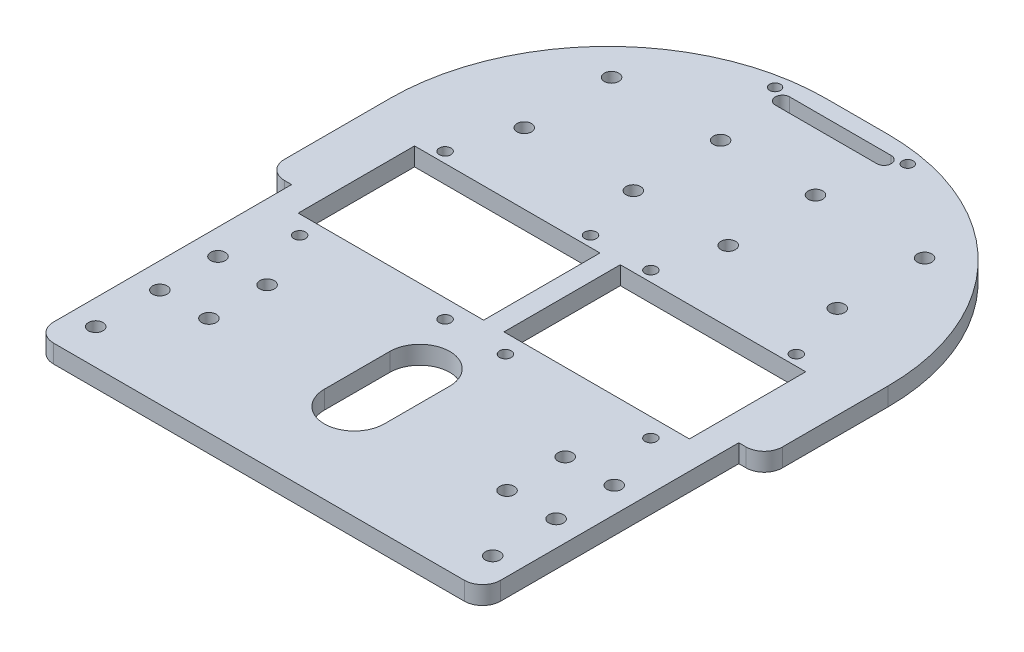
from build123d import *

# Parameters (mm, degrees)
BOSS_EXTRUDE2_DEPTH = 5
FILLET8_R           = 60
SKETCH4_R           = 2
SKETCH4_R_2         = 1.605
SKETCH4_R_3         = 1.5
SKETCH4_W           = 51
SKETCH4_H           = 32
CUT_EXTRUDE1_DEPTH  = 5
FILLET17_R          = 5


with BuildPart() as part:
    # Sketch1 → Boss-Extrude2 (new body)
    with BuildSketch(Plane(origin=(0, 0, 0), x_dir=(1, 0, 0), z_dir=(0, 1, 0))):
        Polygon((68.5, 80), (-68.5, 80), (-68.5, -14), (-61.5, -14), (-61.5, -84.5), (61.5, -84.5), (61.5, -14), (68.5, -14), align=None)
    extrude(amount=BOSS_EXTRUDE2_DEPTH)

    # Fillet8
    fillet8_edges = [part.edges().sort_by_distance(p)[0] for p in [
        (68.5, 2.5, -80),
        (-68.5, 2.5, -80),
    ]]
    fillet(fillet8_edges, radius=FILLET8_R)

    # Sketch4 → Cut-Extrude1 (cut)
    with BuildSketch(Plane(origin=(0, 5, 0), x_dir=(1, 0, 0), z_dir=(0, 1, 0))):
        with Locations((-41, -41.25)):
            Circle(SKETCH4_R)
        with Locations((41, -41.25)):
            Circle(SKETCH4_R)
        with Locations((41, -57.25)):
            Circle(SKETCH4_R)
        with Locations((-41, -57.25)):
            Circle(SKETCH4_R)
        with Locations((-54.5, -41.25)):
            Circle(SKETCH4_R)
        with Locations((-54.5, -57.25)):
            Circle(SKETCH4_R)
        with Locations((54.5, -57.25)):
            Circle(SKETCH4_R)
        with Locations((54.5, -41.25)):
            Circle(SKETCH4_R)
        with Locations((-48.298883815, 15.012633239)):
            Circle(SKETCH4_R_2)
        with Locations((-8.298883815, 15.012633239)):
            Circle(SKETCH4_R_2)
        with Locations((-48.298883815, -24.987366761)):
            Circle(SKETCH4_R_2)
        with Locations((-8.298883815, -24.987366761)):
            Circle(SKETCH4_R_2)
        with Locations((48.298883815, -24.987366761)):
            Circle(SKETCH4_R_2)
        with Locations((8.298883815, -24.987366761)):
            Circle(SKETCH4_R_2)
        with Locations((8.298883815, 15.012633239)):
            Circle(SKETCH4_R_2)
        with Locations((48.298883815, 15.012633239)):
            Circle(SKETCH4_R_2)
        with Locations((13.047144734, 55.54428083)):
            Circle(SKETCH4_R)
        with Locations((43.047144734, 55.54428083)):
            Circle(SKETCH4_R)
        with Locations((43.047144734, 31.54428083)):
            Circle(SKETCH4_R)
        with Locations((13.047144734, 31.54428083)):
            Circle(SKETCH4_R)
        with Locations((-43.047144734, 55.54428083)):
            Circle(SKETCH4_R)
        with Locations((-43.047144734, 31.54428083)):
            Circle(SKETCH4_R)
        with Locations((-13.047144734, 31.54428083)):
            Circle(SKETCH4_R)
        with Locations((-13.047144734, 55.54428083)):
            Circle(SKETCH4_R)
        with Locations((-18.180285112, 75.652692178)):
            Circle(SKETCH4_R_3)
        with Locations((18.319714888, 75.652692178)):
            Circle(SKETCH4_R_3)
        with Locations((-54.599046458, -74.796312774)):
            Circle(SKETCH4_R)
        with Locations((54.599046458, -74.796312774)):
            Circle(SKETCH4_R)
        with BuildLine():
            Line((8.255924755, -40.25), (8.255924755, -58.25))
            ThreePointArc((8.255924755, -58.25), (0, -66.505924755), (-8.255924755, -58.25))
            Line((-8.255924755, -58.25), (-8.255924755, -40.25))
            ThreePointArc((-8.255924755, -40.25), (0, -31.994075245), (8.255924755, -40.25))
        make_face()
        with Locations((-28.298883815, -3.887366761)):
            Rectangle(SKETCH4_W, SKETCH4_H)
        with Locations((28.298883815, -3.887366761)):
            Rectangle(SKETCH4_W, SKETCH4_H)
        with BuildLine():
            Line((-13.900285112, 75.389960782), (14.039714888, 75.389960782))
            ThreePointArc((14.039714888, 75.389960782), (16.006983492, 73.422692178), (14.039714888, 71.455423574))
            Line((14.039714888, 71.455423574), (-13.900285112, 71.455423574))
            ThreePointArc((-13.900285112, 71.455423574), (-15.867553716, 73.422692178), (-13.900285112, 75.389960782))
        make_face()
    extrude(amount=-CUT_EXTRUDE1_DEPTH, mode=Mode.SUBTRACT)

    # Fillet17
    fillet17_edges = [part.edges().sort_by_distance(p)[0] for p in [
        (68.5, 2.5, 14),
        (61.5, 2.5, 84.5),
        (-61.5, 2.5, 84.5),
        (-68.5, 2.5, 14),
    ]]
    fillet(fillet17_edges, radius=FILLET17_R)


solid = part.part
